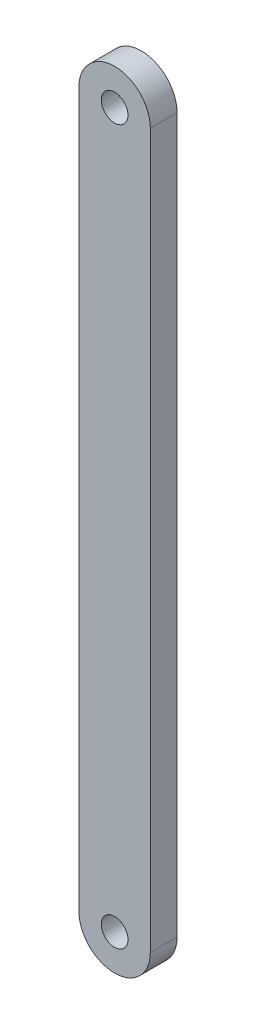
from build123d import *

# Parameters (mm, degrees)
SKETCH_3_R      = 1.5
EXTRUDE_2_DEPTH = 3


with BuildPart() as part:
    # 草圖3 → 填料-伸長2 (new body)
    with BuildSketch(Plane.XY):
        with BuildLine():
            Line((2198.740145456, 1571.08621907), (2198.740145456, 1572.08621907))
            Line((2198.740145456, 1572.08621907), (2198.740145455, 1577.10008841))
            ThreePointArc((2198.740145455, 1577.10008841), (2202.740145455, 1581.100088409), (2206.740145455, 1577.10008841))
            Line((2206.740145455, 1577.10008841), (2206.740145456, 1564.741602734))
            Line((2206.740145456, 1564.741602734), (2206.740145456, 1563.741602734))
            Line((2206.740145456, 1563.741602734), (2206.740145456, 1542.60008841))
            Line((2206.740145456, 1542.60008841), (2206.740145456, 1541.60008841))
            Line((2206.740145456, 1541.60008841), (2206.740145456, 1517.144473865))
            Line((2206.740145456, 1517.144473865), (2206.740145456, 1516.144473865))
            Line((2206.740145456, 1516.144473865), (2206.740145455, 1497.100088413))
            ThreePointArc((2206.740145455, 1497.100088413), (2202.740145455, 1493.100088409), (2198.740145455, 1497.100088412))
            Line((2198.740145455, 1497.100088412), (2198.740145456, 1515.966387039))
            Line((2198.740145456, 1515.966387039), (2198.740145456, 1516.966387039))
            Line((2198.740145456, 1516.966387039), (2198.740145456, 1541.60008841))
            Line((2198.740145456, 1541.60008841), (2198.740145456, 1542.60008841))
            Line((2198.740145456, 1542.60008841), (2198.740145456, 1571.08621907))
        make_face()
        with Locations((2202.740145455, 1577.100088409)):
            Circle(SKETCH_3_R, mode=Mode.SUBTRACT)
        with Locations((2202.740145455, 1497.100088409)):
            Circle(SKETCH_3_R, mode=Mode.SUBTRACT)
    extrude(amount=EXTRUDE_2_DEPTH)


solid = part.part
